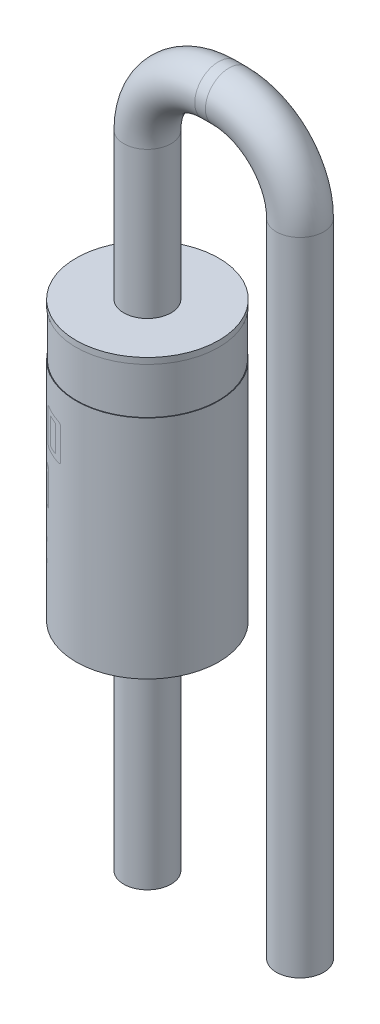
from build123d import *

# Parameters (mm, degrees)
SKETCH1_R     = 1.1875
BODY_DEPTH    = 2.3175
CATHODE_START = 0.1
SKETCH8_R     = 1.1975
SKETCH8_R_2   = 1.1775
CATHODE_DEPTH = 0.7725
SKETCH6_R     = 0.39375


with BuildPart() as part:
    # Sketch1 → BODY (new, symmetric)
    with BuildSketch(Plane(origin=(0, 3.3175, 0), x_dir=(1, 0, 0), z_dir=(0, 1, 0))):
        Circle(SKETCH1_R)
    extrude(amount=BODY_DEPTH, both=True)

    # Sketch8 → CATHODE (cut)
    with BuildSketch(Plane(origin=(0, 5.635, 0), x_dir=(0, 0, 1), z_dir=(0, -1, 0)).offset(CATHODE_START)):
        Circle(SKETCH8_R)
        Circle(SKETCH8_R_2, mode=Mode.SUBTRACT)
    extrude(amount=CATHODE_DEPTH, mode=Mode.SUBTRACT)

    # PINS: sweep along a path in Sketch7
    with BuildLine(Plane.XY) as pins_path:
        Line((0, -2.6), (0, 8.073246839))
        ThreePointArc((0, 8.073246839), (0.345980115, 8.908516724), (1.18125, 9.254496839))
        Line((1.18125, 9.254496839), (1.35875, 9.254496839))
        ThreePointArc((1.35875, 9.254496839), (2.194019885, 8.908516724), (2.54, 8.073246839))
        Line((2.54, 8.073246839), (2.54, -2.6))
    # Sketch6 → PINS (sweep)
    with BuildSketch(Plane(origin=(0, 3.3175, 0), x_dir=(1, 0, 0), z_dir=(0, 1, 0))):
        Circle(SKETCH6_R)
    sweep(path=pins_path.line)


solid = part.part
